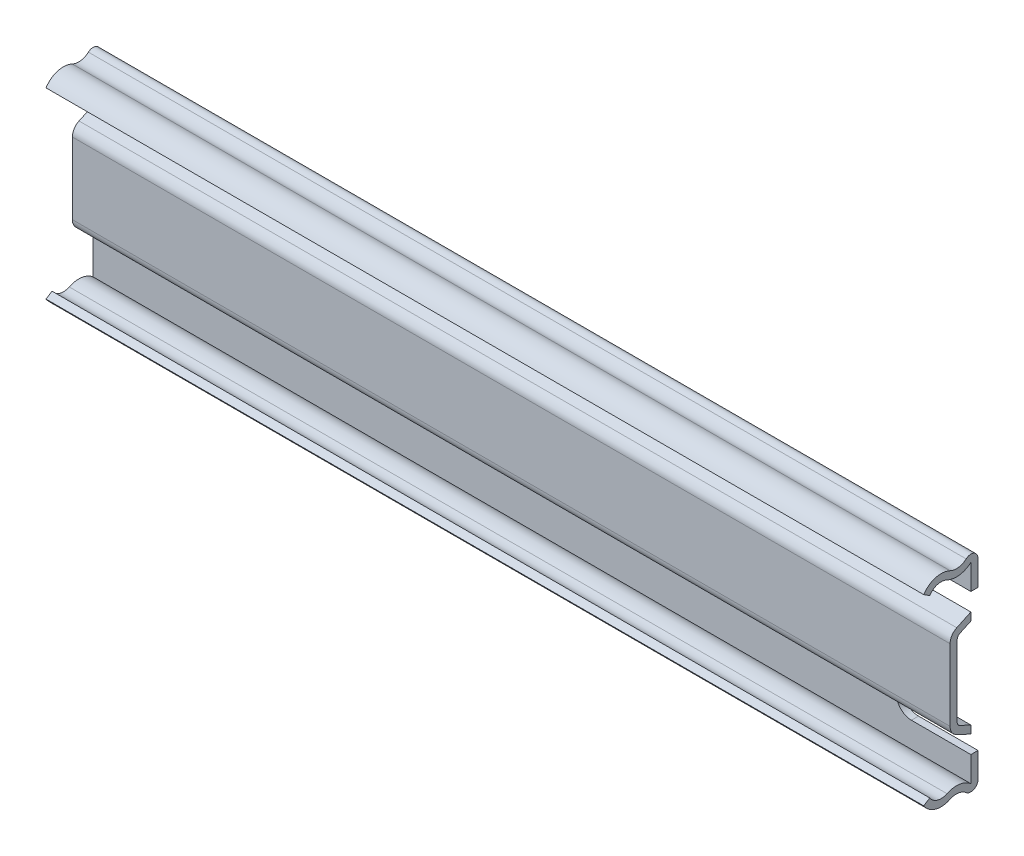
from build123d import *

# Parameters (mm, degrees)
BOSS_EXTRUDE1_DEPTH = 150
SKETCH2_W           = 12.7
SKETCH2_H           = 24.13
CUT_EXTRUDE1_DEPTH  = 156.216502449
SKETCH3_W           = 149.993973466
SKETCH3_H           = 14.75620072
BOSS_EXTRUDE2_DEPTH = 3.55599999
SKETCH4_W           = 3.55599999
SKETCH4_H           = 13.202768596
CUT_EXTRUDE2_DEPTH  = 152.137564539
DRAFT1_START        = -153.930973466
DRAFT1_DEPTH        = 149.993973466
DRAFT2_START        = -153.937
DRAFT2_DEPTH        = 150
FILLET1_R           = 0.76200009
FILLET2_R           = 1.98120009
FILLET3_R           = 2.54


# Read off the part's stored shape, not the designer's step: Draft1, Draft2
with BuildPart() as part:
    # Sketch1 → Boss-Extrude1 (new body)
    with BuildSketch(Plane(origin=(-3.937, 0, 0), x_dir=(0, 0, -1), z_dir=(1, 0, 0))):
        with BuildLine():
            Line((2.311399989, 16.37657286), (2.311399989, -16.37657286))
            ThreePointArc((2.311399989, -16.37657286), (0.354826715, -15.481038557), (-1.770730805, -15.815950332))
            ThreePointArc((-1.770730805, -15.815950332), (-3.400639082, -15.955235788), (-4.710462095, -14.975253591))
            Line((-4.710462095, -14.975253591), (-5.7404, -15.627692517))
            ThreePointArc((-5.7404, -15.627692517), (-3.73586423, -17.127444277), (-1.241474216, -16.914283663))
            ThreePointArc((-1.241474216, -16.914283663), (0.188944014, -16.688900954), (1.505642365, -17.291560998))
            ThreePointArc((1.505642365, -17.291560998), (2.81343034, -17.487614789), (3.53059999, -16.37657286))
            Line((3.53059999, -16.37657286), (3.53059999, 16.37657286))
            ThreePointArc((3.53059999, 16.37657286), (2.81343034, 17.487614789), (1.505642365, 17.291560998))
            ThreePointArc((1.505642365, 17.291560998), (0.188944014, 16.688900954), (-1.241474216, 16.914283663))
            ThreePointArc((-1.241474216, 16.914283663), (-3.73586423, 17.127444277), (-5.7404, 15.627692517))
            Line((-5.7404, 15.627692517), (-4.710462095, 14.975253591))
            ThreePointArc((-4.710462095, 14.975253591), (-3.400639082, 15.955235788), (-1.770730805, 15.815950332))
            ThreePointArc((-1.770730805, 15.815950332), (0.354826715, 15.481038557), (2.311399989, 16.37657286))
        make_face()
    extrude(amount=-BOSS_EXTRUDE1_DEPTH)

    # Sketch2 → Cut-Extrude1 (cut, through all)
    with BuildSketch(Plane(origin=(0, 0, -3.53059999), x_dir=(-1, 0, 0), z_dir=(0, 0, -1))):
        with Locations((10.287, 0)):
            Rectangle(SKETCH2_W, SKETCH2_H)
    extrude(amount=-CUT_EXTRUDE1_DEPTH, mode=Mode.SUBTRACT)

    # Sketch3 → Boss-Extrude2 (add)
    with BuildSketch(Plane.XY.offset(-2.311399989)):
        with Locations((-78.933986733, 0)):
            Rectangle(SKETCH3_W, SKETCH3_H)
    extrude(amount=BOSS_EXTRUDE2_DEPTH)

    # Sketch4 → Cut-Extrude2 (cut, through all)
    with BuildSketch(Plane.ZY.offset(153.937)):
        with Locations((-1.752599995, 0)):
            Rectangle(SKETCH4_W, SKETCH4_H)
    extrude(amount=-CUT_EXTRUDE2_DEPTH, mode=Mode.SUBTRACT)

    # Draft1 outline → Draft1 (add)
    with BuildSketch(Plane.YZ.offset(DRAFT1_START)):
        Polygon((7.37810036, 1.244600001), (7.37810036, -2.311399989), (9.036290388, -2.311399989), align=None)
        Polygon((-7.37810036, 1.244600001), (-9.036290388, -2.311399989), (-7.37810036, -2.311399989), align=None)
    extrude(amount=DRAFT1_DEPTH)

    # Draft2 outline → Draft2 (cut)
    with BuildSketch(Plane.YZ.offset(DRAFT2_START)):
        Polygon((6.601384298, 0.0254), (6.601384298, -3.53059999), (8.259574326, -3.53059999), align=None)
        Polygon((-8.259574326, -3.53059999), (-6.601384298, -3.53059999), (-6.601384298, 0.0254), align=None)
    extrude(amount=DRAFT2_DEPTH, mode=Mode.SUBTRACT)

    # Fillet1
    fillet1_edges = [part.edges().sort_by_distance(p)[0] for p in [
        (-85.283986733, -9.036290388, -2.311399989),
        (-85.283986733, 9.036290388, -2.311399989),
        (-78.933986733, 6.601384298, 0.0254),
        (-78.933986733, -6.601384298, 0.0254),
    ]]
    fillet(fillet1_edges, radius=FILLET1_R)

    # Fillet2
    fillet2_edges = [part.edges().sort_by_distance(p)[0] for p in [
        (-78.933986733, -7.37810036, 1.244600001),
        (-78.933986733, 7.37810036, 1.244600001),
        (-85.287, -8.259574326, -3.53059999),
        (-85.287, 8.259574326, -3.53059999),
    ]]
    fillet(fillet2_edges, radius=FILLET2_R)

    # Fillet3
    fillet3_edges = [part.edges().sort_by_distance(p)[0] for p in [
        (-16.637, 12.065, -2.92099999),
        (-16.637, -12.065, -2.92099999),
    ]]
    fillet(fillet3_edges, radius=FILLET3_R)


solid = part.part
